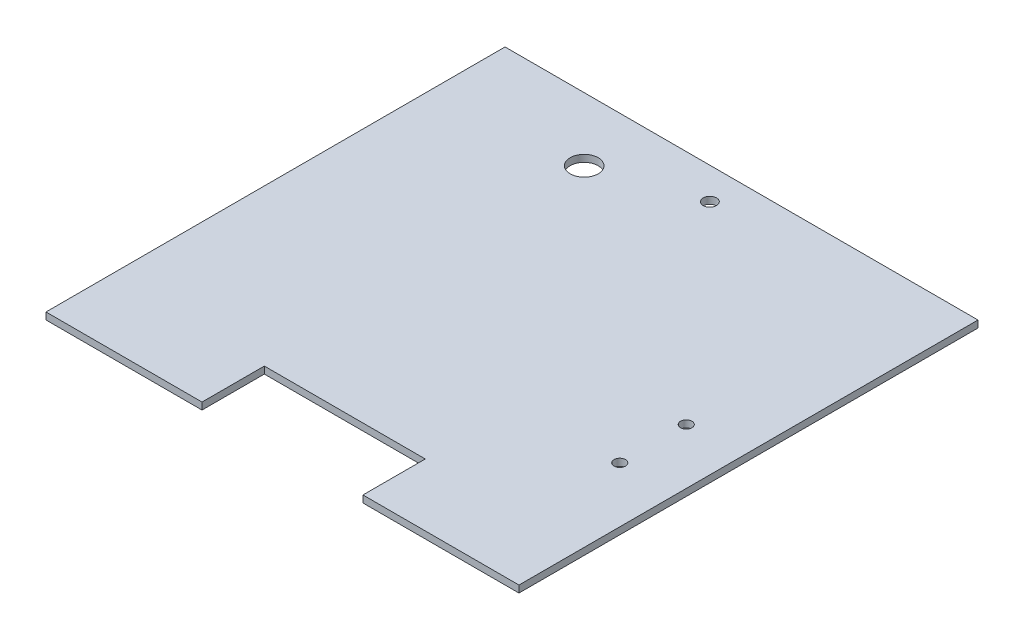
from build123d import *

# Parameters (mm, degrees)
SKETCH1_W           = 189.738
SKETCH1_H           = 184.15
BOSS_EXTRUDE1_DEPTH = 2.794
SKETCH2_R           = 2.6797
CUT_EXTRUDE1_DEPTH  = 133.233653893
CUT_EXTRUDE2_DEPTH  = 133.233653893
SKETCH5_R           = 2.286
SKETCH5_R_2         = 5.6134
CUT_EXTRUDE3_DEPTH  = 133.233653893


with BuildPart() as part:
    # Sketch1 → Boss-Extrude1 (new body)
    with BuildSketch(Plane(origin=(0, 0, 0), x_dir=(1, 0, 0), z_dir=(0, 1, 0))):
        Rectangle(SKETCH1_W, SKETCH1_H)
    extrude(amount=BOSS_EXTRUDE1_DEPTH)

    # Sketch2 → Cut-Extrude1 (cut, through all)
    with BuildSketch(Plane(origin=(0, 2.794, 0), x_dir=(1, 0, 0), z_dir=(0, 1, 0))):
        with Locations((0, 79.375)):
            Circle(SKETCH2_R)
    extrude(amount=-CUT_EXTRUDE1_DEPTH, mode=Mode.SUBTRACT)

    # Sketch3 → Cut-Extrude2 (cut, through all)
    with BuildSketch(Plane(origin=(0, 2.794, 0), x_dir=(1, 0, 0), z_dir=(0, 1, 0))):
        Polygon((0, -92.075), (-32.28, -92.075), (-32.28, -67.074999962), (32.28, -67.074999962), (32.28, -92.075), align=None)
    extrude(amount=-CUT_EXTRUDE2_DEPTH, mode=Mode.SUBTRACT)

    # Sketch5 → Cut-Extrude3 (cut, through all)
    with BuildSketch(Plane(origin=(0, 2.794, 0), x_dir=(1, 0, 0), z_dir=(0, 1, 0))):
        with Locations((72.644, -2.74359)):
            Circle(SKETCH5_R)
        with Locations((72.644, -29.41359)):
            Circle(SKETCH5_R)
        with Locations((-37.719, 66.675)):
            Circle(SKETCH5_R_2)
    extrude(amount=-CUT_EXTRUDE3_DEPTH, mode=Mode.SUBTRACT)


solid = part.part
